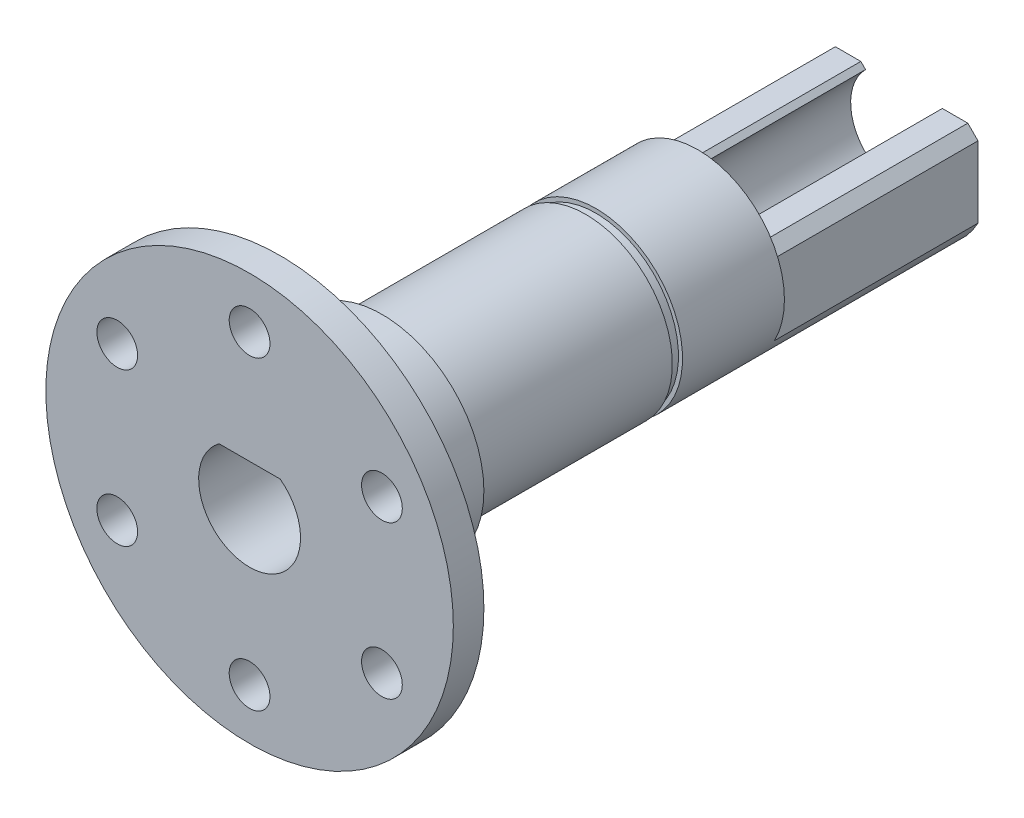
from build123d import *

# Parameters (mm, degrees)
SKETCH_1_R               = 8.5
EXTRUDE_1_DEPTH          = 33
SKETCH_2_R               = 8.5
EXTRUDE_2_DEPTH          = 11
SKETCH_3_R               = 10
EXTRUDE_3_DEPTH          = 10
CHAMFER_2_SIZE           = 0.5
SKETCH_12_W              = 1
SKETCH_12_H              = 0.4
SKETCH_13_R              = 5
CUT_EXTRUDE_1_DEPTH      = 20
EXTRUDE_START            = 7.5
SKETCH_19_R              = 8.5
EXTRUDE_6_DEPTH          = 7.5
SKETCH_20_R              = 5
CUT_EXTRUDE_5_DEPTH      = 7.5
CUT_EXTRUDE_6_DEPTH      = 16.5
CUT_EXTRUDE_6_DEPTH_BACK = 16.5
SKETCH_21_R              = 1.5
SKETCH_14_R              = 20
SKETCH_14_R_2            = 2
EXTRUDE_7_DEPTH          = 3
EXTRUDE_START_2          = 7
SKETCH_23_R              = 5
EXTRUDE_8_DEPTH          = 7
CUT_EXTRUDE_START        = -44
SKETCH_24_R              = 5
CUT_EXTRUDE_7_DEPTH      = 44
SKETCH_31_R              = 7
SKETCH_31_R_2            = 5
EXTRUDE_10_DEPTH         = 20
EXTRUDE_11_DEPTH         = 84
SKETCH_33_R              = 1.5
CUT_EXTRUDE_8_DEPTH      = 26
EXTRUDE_START_3          = -3
SKETCH_35_R              = 13
SKETCH_35_R_2            = 7
EXTRUDE_12_DEPTH         = 3
SKETCH_36_R              = 1.5
CUT_EXTRUDE_10_DEPTH     = 3
CUT_EXTRUDE_START_2      = -20
SKETCH_38_R              = 20
CUT_EXTRUDE_12_DEPTH     = 20
SKETCH_39_W              = 15
SKETCH_39_H              = 6.010679791
CUT_EXTRUDE_13_DEPTH     = 20
SKETCH_40_W              = 3.690554248
SKETCH_40_H              = 8
SKETCH_40_W_2            = 3.213479815
CUT_EXTRUDE_14_DEPTH     = 20
SKETCH_42_W              = 19.43068456
SKETCH_42_H              = 3.441553847
CUT_EXTRUDE_16_DEPTH     = 20
CHAMFER_5_SIZE           = 1
CHAMFER_6_SIZE           = 1


with BuildPart() as part:
    # 草图1 → 凸台-拉伸1 (new body)
    with BuildSketch(Plane.XY):
        Circle(SKETCH_1_R)
    extrude(amount=EXTRUDE_1_DEPTH)

    # 草图2 → 凸台-拉伸2 (add)
    with BuildSketch(Plane.XY.offset(33)):
        Circle(SKETCH_2_R)
    extrude(amount=EXTRUDE_2_DEPTH)

    # 草图3 → 凸台-拉伸3 (add)
    with BuildSketch(Plane.XY.offset(44)):
        Circle(SKETCH_3_R)
    extrude(amount=EXTRUDE_3_DEPTH)

    # 倒角2
    chamfer_2_edges = [part.edges().sort_by_distance(p)[0] for p in [
        (-8.5, 0, 0),
    ]]
    chamfer(chamfer_2_edges, length=CHAMFER_2_SIZE)

    # 草图12 → 切除-旋转1 (revolve, cut)
    with BuildSketch(Plane(origin=(0, 0, 0), x_dir=(0, 0, -1), z_dir=(1, 0, 0)), mode=Mode.PRIVATE) as cut_revolve_1_sk:
        with Locations((-23.5, 8.3)):
            Rectangle(SKETCH_12_W, SKETCH_12_H)
    revolve(cut_revolve_1_sk.sketch.rotate(Axis((0, 0, 0), (0, 0, 1)), 90), axis=Axis((0, 0, 0), (0, 0, 1)), mode=Mode.SUBTRACT)

    # 草图13 → 切除-拉伸1 (cut)
    with BuildSketch(Plane(origin=(0, 0, 0), x_dir=(-1, 0, 0), z_dir=(0, 0, -1))):
        Circle(SKETCH_13_R)
    extrude(amount=-CUT_EXTRUDE_1_DEPTH, mode=Mode.SUBTRACT)

    # 草图19 → 凸台-拉伸6 (add)
    with BuildSketch(Plane(origin=(0, 0, 0.5), x_dir=(-1, 0, 0), z_dir=(0, 0, -1)).offset(EXTRUDE_START)):
        Circle(SKETCH_19_R)
    extrude(amount=-EXTRUDE_6_DEPTH)

    # 草图20 → 切除-拉伸5 (cut)
    with BuildSketch(Plane(origin=(0, 0, -7), x_dir=(-1, 0, 0), z_dir=(0, 0, -1))):
        Circle(SKETCH_20_R)
    extrude(amount=-CUT_EXTRUDE_5_DEPTH, mode=Mode.SUBTRACT)

    # 草图21 → 切除-拉伸6 (cut, two sides: drawn at the far end of the back side and taken through both)
    with BuildSketch(Plane(origin=(0, 0, 0), x_dir=(1, 0, 0), z_dir=(0, 1, 0)).offset(-CUT_EXTRUDE_6_DEPTH_BACK)):
        with Locations(Location((0, -3, 0), (0, 0, 90))):
            Circle(SKETCH_21_R)
    extrude(amount=CUT_EXTRUDE_6_DEPTH + CUT_EXTRUDE_6_DEPTH_BACK, mode=Mode.SUBTRACT)

    # 草图14 → 凸台-拉伸7 (add)
    with BuildSketch(Plane.XY.offset(54)):
        Circle(SKETCH_14_R)
        with Locations((0, 15)):
            Circle(SKETCH_14_R_2, mode=Mode.SUBTRACT)
        with Locations((12.990381057, 7.5)):
            Circle(SKETCH_14_R_2, mode=Mode.SUBTRACT)
        with Locations((12.990381057, -7.5)):
            Circle(SKETCH_14_R_2, mode=Mode.SUBTRACT)
        with Locations((0, -15)):
            Circle(SKETCH_14_R_2, mode=Mode.SUBTRACT)
        with Locations((-12.990381057, -7.5)):
            Circle(SKETCH_14_R_2, mode=Mode.SUBTRACT)
        with Locations((-12.990381057, 7.5)):
            Circle(SKETCH_14_R_2, mode=Mode.SUBTRACT)
    extrude(amount=EXTRUDE_7_DEPTH)

    # 草图23 → 凸台-拉伸8 (add)
    with BuildSketch(Plane(origin=(0, 0, 20), x_dir=(-1, 0, 0), z_dir=(0, 0, -1)).offset(EXTRUDE_START_2)):
        Circle(SKETCH_23_R)
    extrude(amount=-EXTRUDE_8_DEPTH)

    # 草图24 → 切除-拉伸7 (cut)
    with BuildSketch(Plane.XY.offset(57).offset(CUT_EXTRUDE_START)):
        with Locations(Location((0, 0, 0), (0, 0, 180))):
            Circle(SKETCH_24_R)
    extrude(amount=CUT_EXTRUDE_7_DEPTH, mode=Mode.SUBTRACT)

    # 草图31 → 凸台-拉伸10 (add)
    with BuildSketch(Plane.XY.offset(57)):
        Circle(SKETCH_31_R)
        with Locations(Location((0, 0, 0), (0, 0, 180))):
            Circle(SKETCH_31_R_2, mode=Mode.SUBTRACT)
    extrude(amount=EXTRUDE_10_DEPTH)

    # 草图32 → 凸台-拉伸11 (add)
    with BuildSketch(Plane(origin=(0, 0, -7), x_dir=(-1, 0, 0), z_dir=(0, 0, -1))):
        with BuildLine():
            Line((-3, 4), (3, 4))
            ThreePointArc((3, 4), (0, 5), (-3, 4))
        make_face()
    extrude(amount=-EXTRUDE_11_DEPTH)

    # 草图33 → 切除-拉伸8 (cut)
    with BuildSketch(Plane.XZ.offset(-4)):
        with Locations(Location((0, 3, 0), (0, 0, 270))):
            Circle(SKETCH_33_R)
    extrude(amount=-CUT_EXTRUDE_8_DEPTH, mode=Mode.SUBTRACT)

    # 草图35 → 凸台-拉伸12 (add)
    with BuildSketch(Plane.XY.offset(74).offset(EXTRUDE_START_3)):
        Circle(SKETCH_35_R)
        Circle(SKETCH_35_R_2, mode=Mode.SUBTRACT)
    extrude(amount=EXTRUDE_12_DEPTH)

    # 草图36 → 切除-拉伸10 (cut)
    with BuildSketch(Plane.XY.offset(74)):
        with Locations((0, 10)):
            Circle(SKETCH_36_R)
        with Locations((8.660254038, 5)):
            Circle(SKETCH_36_R)
        with Locations((8.660254038, -5)):
            Circle(SKETCH_36_R)
        with Locations((0, -10)):
            Circle(SKETCH_36_R)
        with Locations((-8.660254038, -5)):
            Circle(SKETCH_36_R)
        with Locations((-8.660254038, 5)):
            Circle(SKETCH_36_R)
    extrude(amount=-CUT_EXTRUDE_10_DEPTH, mode=Mode.SUBTRACT)

    # 草图38 → 切除-拉伸12 (cut)
    with BuildSketch(Plane.XY.offset(77).offset(CUT_EXTRUDE_START_2)):
        Circle(SKETCH_38_R)
    extrude(amount=CUT_EXTRUDE_12_DEPTH, mode=Mode.SUBTRACT)

    # 草图39 → 切除-拉伸13 (cut)
    with BuildSketch(Plane(origin=(0, 0, -7), x_dir=(-1, 0, 0), z_dir=(0, 0, -1))):
        with Locations((0, 7.005339896)):
            Rectangle(SKETCH_39_W, SKETCH_39_H)
    extrude(amount=-CUT_EXTRUDE_13_DEPTH, mode=Mode.SUBTRACT)

    # 草图40 → 切除-拉伸14 (cut)
    with BuildSketch(Plane(origin=(0, 0, -7), x_dir=(-1, 0, 0), z_dir=(0, 0, -1))):
        with Locations((-9.345277124, 0)):
            Rectangle(SKETCH_40_W, SKETCH_40_H)
        with Locations((9.106739908, 0)):
            Rectangle(SKETCH_40_W_2, SKETCH_40_H)
    extrude(amount=-CUT_EXTRUDE_14_DEPTH, mode=Mode.SUBTRACT)

    # 草图42 → 切除-拉伸16 (cut)
    with BuildSketch(Plane(origin=(0, 0, -7), x_dir=(-1, 0, 0), z_dir=(0, 0, -1))):
        with Locations((-0.246054433, -8.720776924)):
            Rectangle(SKETCH_42_W, SKETCH_42_H)
    extrude(amount=-CUT_EXTRUDE_16_DEPTH, mode=Mode.SUBTRACT)

    # 倒角5
    chamfer_5_edges = [part.edges().sort_by_distance(p)[0] for p in [
        (-7.5, 4, 3),
        (7.5, 4, 3),
    ]]
    chamfer(chamfer_5_edges, length=CHAMFER_5_SIZE)

    # 倒角6
    # the kernel refuses this chamfer: 1, 0.714285714 mm, written as the material it takes off along each edge
    with BuildSketch(Plane(origin=(-3, 4, -9.571682988), x_dir=(-1, 0, 0), z_dir=(0, 0, 1)), Plane(origin=(3, 4, 13), x_dir=(1, 0, 0), z_dir=(0, 0, -1))) as chamfer_6_piece_1:
        with BuildLine():
            Line((CHAMFER_6_SIZE, 0), (0.535533906, 0.464466094))
            ThreePointArc((0.535533906, 0.464466094), (0.274930492, 0.221795364), (0, 0))
            Line((0, 0), (CHAMFER_6_SIZE, 0))
        make_face()
    extrude(amount=22.571682988, mode=Mode.SUBTRACT)


solid = part.part
